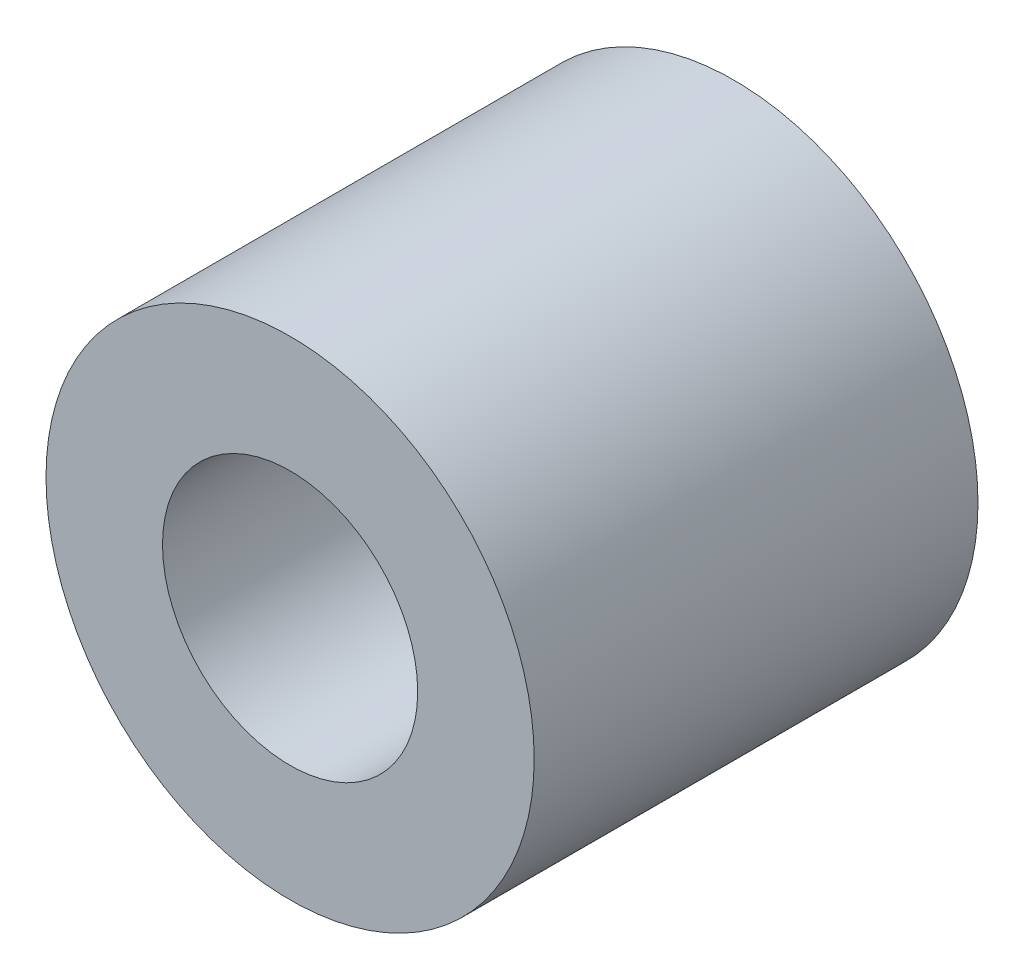
from build123d import *

# Parameters (mm, degrees)
SKETCH_1_R      = 2.2
SKETCH_1_R_2    = 1.15
EXTRUDE_2_DEPTH = 4


with BuildPart() as part:
    # 草图1 → 凸台-拉伸2 (new body)
    with BuildSketch(Plane.XY):
        Circle(SKETCH_1_R)
        Circle(SKETCH_1_R_2, mode=Mode.SUBTRACT)
    extrude(amount=EXTRUDE_2_DEPTH)


solid = part.part
